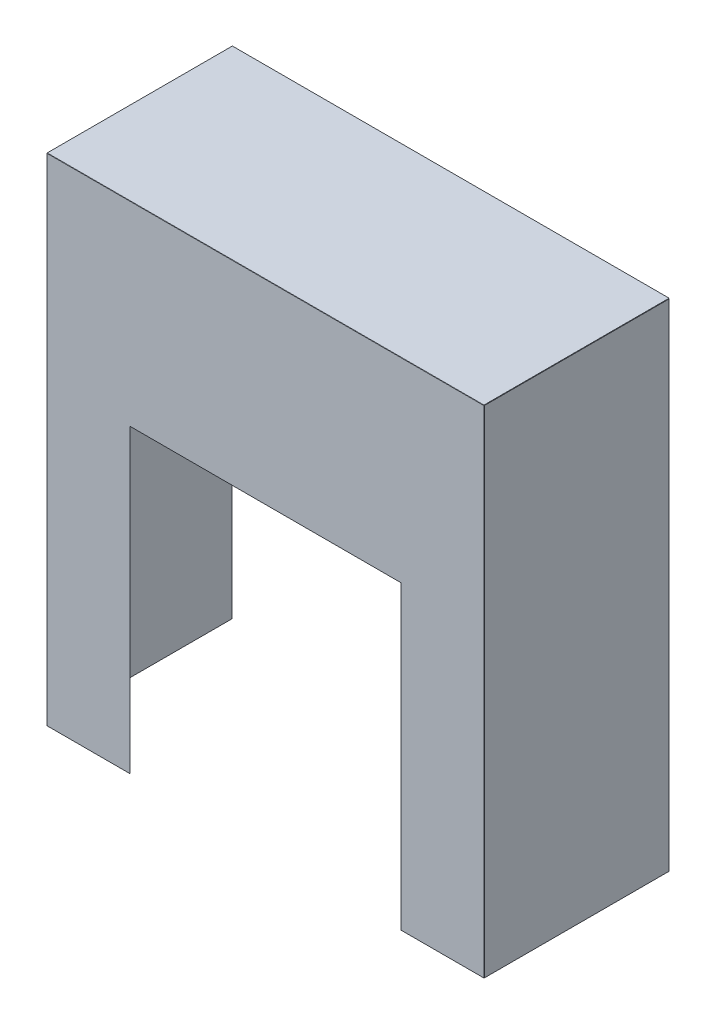
from build123d import *

# Parameters (mm, degrees)
SKETCH1_W          = 2950
SKETCH1_H          = 1250
BASE_FLANGE1_DEPTH = 1.27
EDGE_FLANGE1_DEPTH = 2950
EDGE_FLANGE2_DEPTH = 3347.9934
EDGE_FLANGE3_DEPTH = 3347.9934
CUT_EXTRUDE1_REACH = 4639.28
SKETCH16_W         = 1828.8
SKETCH16_H         = 2032


# Sheet-metal steps are written as plain solids
with BuildPart() as part:
    # Sketch1 → Base-Flange1 (new body)
    with BuildSketch(Plane(origin=(0, 0, 0), x_dir=(1, 0, 0), z_dir=(0, 1, 0))):
        with Locations((-1475, 625)):
            Rectangle(SKETCH1_W, SKETCH1_H)
    extrude(amount=-BASE_FLANGE1_DEPTH)

    # Edge-Flange1 section (across the edge) → Edge-Flange1 (add)
    with BuildSketch(Plane(origin=(0, -1.27, 0.7366), x_dir=(0, 0, -1), z_dir=(-1, 0, 0))):
        with BuildLine():
            Line((-1.27, 0.7366), (-1.27, 3348.73))
            Line((-1.27, 3348.73), (0, 3348.73))
            Line((0, 3348.73), (0, 0.7366))
            ThreePointArc((0, 0.7366), (0.215745145, 0.215745145), (0.7366, 0))
            Line((0.7366, 0), (0.7366, -1.27))
            ThreePointArc((0.7366, -1.27), (-0.682280467, -0.682280467), (-1.27, 0.7366))
        make_face()
    extrude(amount=EDGE_FLANGE1_DEPTH)

    # Edge-Flange2 section (across the edge) → Edge-Flange2 (add)
    with BuildSketch(Plane(origin=(0.7366, -2.0066, 0.7366), x_dir=(-1, 0, 0), z_dir=(0, -1, 0))):
        with BuildLine():
            Line((-1.27, 0.7366), (-1.27, 1248.73))
            Line((-1.27, 1248.73), (0, 1248.73))
            Line((0, 1248.73), (0, 0.7366))
            ThreePointArc((0, 0.7366), (0.215745145, 0.215745145), (0.7366, 0))
            Line((0.7366, 0), (0.7366, -1.27))
            ThreePointArc((0.7366, -1.27), (-0.682280467, -0.682280467), (-1.27, 0.7366))
        make_face()
    extrude(amount=EDGE_FLANGE2_DEPTH)

    # Edge-Flange3 section (across the edge) → Edge-Flange3 (add)
    with BuildSketch(Plane(origin=(-2950.7366, -3350, 0.7366), x_dir=(1, 0, 0), z_dir=(0, 1, 0))):
        with BuildLine():
            Line((-1.27, 0.7366), (-1.27, 1248.73))
            Line((-1.27, 1248.73), (0, 1248.73))
            Line((0, 1248.73), (0, 0.7366))
            ThreePointArc((0, 0.7366), (0.215745145, 0.215745145), (0.7366, 0))
            Line((0.7366, 0), (0.7366, -1.27))
            ThreePointArc((0.7366, -1.27), (-0.682280467, -0.682280467), (-1.27, 0.7366))
        make_face()
    extrude(amount=EDGE_FLANGE3_DEPTH)

    # Sketch16 → Cut-Extrude1 (cut, up to next)
    with BuildSketch(Plane.XY.offset(2.0066), mode=Mode.PRIVATE) as cut_extrude1_sk1:
        with Locations((-1475, -2334)):
            Rectangle(SKETCH16_W, SKETCH16_H)
    cut_extrude1_tool1 = extrude(cut_extrude1_sk1.sketch, amount=-CUT_EXTRUDE1_REACH, mode=Mode.PRIVATE) & part.part
    add(cut_extrude1_tool1.solids().sort_by_distance((-1475, -2334, 2.0066))[0], mode=Mode.SUBTRACT)


solid = part.part
